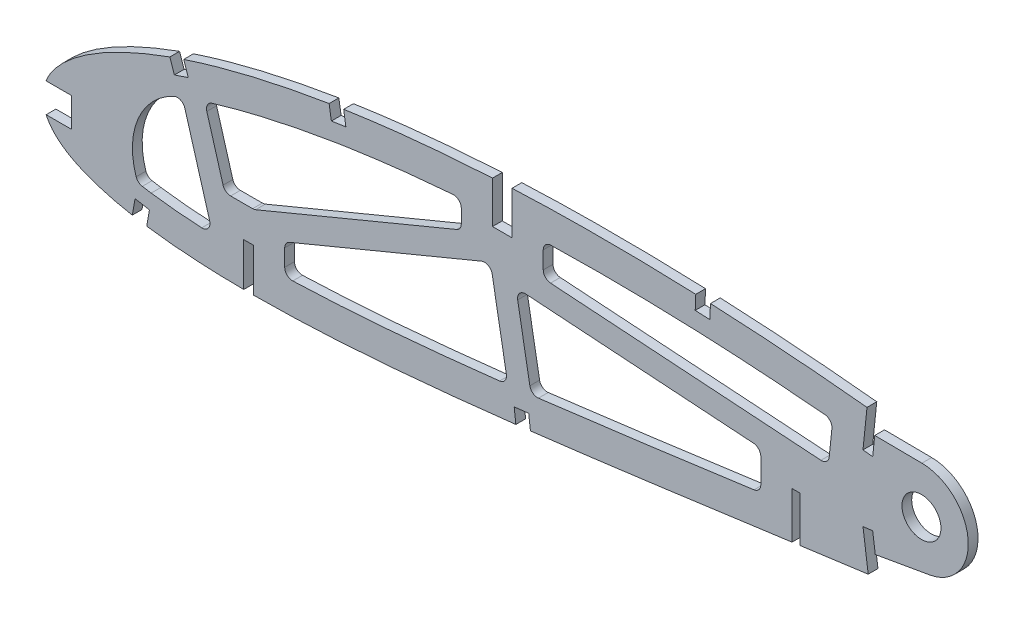
from build123d import *

# Parameters (mm, degrees)
BOSS_EXTRUDE1_DEPTH = 3.175
CUT_EXTRUDE1_DEPTH  = 7.62
SKETCH3_R           = 6.35
CUT_EXTRUDE2_DEPTH  = 7.62
CUT_EXTRUDE3_DEPTH  = 425.770685521
CUT_EXTRUDE4_START  = -3.175
CUT_EXTRUDE4_DEPTH  = 3.175
FILLET1_R           = 2.54


# Read off the part's stored shape, not the designer's step: Cut-Extrude4
with BuildPart() as part:
    # Sketch1 → Boss-Extrude1 (new body)
    with BuildSketch(Plane.XY):
        with BuildLine():
            Line((417.491116248, -0.651692804), (421.450974812, -1.472467044))
            Line((421.450974812, -1.472467044), (418.012470552, 0.651692804))
            add(Edge.make_bspline(
                [(418.012470552, 0.651692804), (417.98044815, 0.671474864), (417.852482746, 0.75052638), (417.564153255, 0.927383578), (417.084024874, 1.221948394), (416.411887136, 1.63217468), (415.548261806, 2.156972941), (414.492714479, 2.792668486), (413.245904156, 3.537195961), (411.808132787, 4.387034494), (410.179547234, 5.338203991), (408.360768057, 6.386852134), (406.351953186, 7.52704122), (404.153880987, 8.754112876), (401.767305606, 10.062231026), (399.19267854, 11.445487716), (396.430921499, 12.896846477), (393.483094762, 14.410065077), (390.349735958, 15.976787411), (387.032322118, 17.590492828), (383.53195848, 19.243135295), (379.849840019, 20.925898146), (375.98808191, 22.631921026), (371.947751923, 24.35059805), (367.731152528, 26.074482818), (363.340078768, 27.793764201), (358.777130588, 29.500612257), (354.044068493, 31.183969527), (349.144430575, 32.836479872), (344.080593504, 34.447407706), (338.856178603, 36.008004406), (333.474221444, 37.508151761), (327.939208494, 38.940156234), (322.254650095, 40.293589254), (316.425364207, 41.559391603), (310.455984511, 42.72994226), (304.351517267, 43.793554912), (298.12887857, 44.749400354), (291.888189265, 45.544501897), (285.660339717, 46.324314327), (279.441765017, 47.05687676), (273.147186285, 47.758406613), (266.78265934, 48.424954116), (260.354497207, 49.054435041), (253.869207533, 49.644132572), (247.333529654, 50.192317352), (240.75378784, 50.695883209), (234.13692006, 51.154054264), (227.48946797, 51.562802699), (220.818511901, 51.921821557), (214.130823757, 52.228606963), (207.433363169, 52.481045058), (200.733241899, 52.677611966), (194.03741489, 52.816424499), (187.353132032, 52.896609907), (180.687346008, 52.915977167), (174.047303325, 52.874179852), (167.439957194, 52.769782806), (160.872561498, 52.601356868), (154.352078932, 52.36858769), (147.885560384, 52.071576223), (141.480086041, 51.707835252), (135.142604697, 51.279682727), (128.880173648, 50.78532016), (122.699673543, 50.224616012), (116.607581601, 49.599907517), (110.610680398, 48.90949561), (104.715396798, 48.155344678), (98.928179068, 47.338933301), (93.255520599, 46.45981687), (87.703498103, 45.520534547), (82.278103773, 44.522047456), (76.985077668, 43.467282827), (71.830182495, 42.356515787), (66.818874958, 41.193078409), (61.956363154, 39.97899758), (57.247874135, 38.716495991), (52.698180969, 37.408603084), (48.311884381, 36.058286041), (44.094097756, 34.667028605), (40.048008795, 33.240105797), (36.178587704, 31.778530584), (32.488798598, 30.286805616), (28.982965605, 28.766967771), (25.66370775, 27.223650228), (22.534781646, 25.658610062), (19.59841729, 24.076231981), (16.857562593, 22.478942324), (14.314855879, 20.869707996), (11.971365892, 19.2526108), (9.830323596, 17.628665848), (7.892464518, 16.001976699), (6.159015004, 14.37502038), (4.632452775, 12.748917707), (3.312722951, 11.12653219), (2.201555106, 9.509148701), (1.299141963, 7.898297704), (0.607524637, 6.295149332), (0.126017388, 4.70060514), (-0.137556514, 3.117018659), (-0.203161624, 1.54312034), (-0.067619355, 0.51360488), (0, 0)],
                knots=[0, 0, 0, 0, 0.00025409, 0.001015373, 0.002283359, 0.004056577, 0.006330981, 0.009105275, 0.01237449, 0.016134023, 0.020379661, 0.025105976, 0.030306237, 0.035972206, 0.042099523, 0.048678063, 0.055701664, 0.063160184, 0.071045824, 0.079349826, 0.08806291, 0.097175756, 0.106678112, 0.116561573, 0.126814275, 0.137428301, 0.148393618, 0.15969976, 0.171338125, 0.183297699, 0.195569604, 0.208143556, 0.221011593, 0.234161831, 0.24758745, 0.261276822, 0.27522271, 0.289414144, 0.3037712, 0.317689227, 0.331784111, 0.346039677, 0.36044387, 0.37498272, 0.389640454, 0.404403317, 0.419256601, 0.434186749, 0.449177265, 0.464214782, 0.479284009, 0.49436974, 0.509457833, 0.524532346, 0.53957932, 0.554582984, 0.569529546, 0.584403417, 0.599190992, 0.613876838, 0.628447475, 0.642888675, 0.657186054, 0.671325546, 0.685294014, 0.699078147, 0.712665095, 0.726042645, 0.739197713, 0.752117586, 0.764792042, 0.777208152, 0.789355685, 0.80122396, 0.812803686, 0.824082909, 0.835054602, 0.845709571, 0.856037853, 0.866033834, 0.875688843, 0.884997719, 0.893953426, 0.902552897, 0.910789386, 0.918660734, 0.926166253, 0.933302626, 0.94007122, 0.94647478, 0.952517526, 0.958204819, 0.963546652, 0.9685566, 0.973249913, 0.977651041, 0.981787043, 0.985694226, 0.989415109, 0.993001157, 0.996508416, 1, 1, 1, 1], degree=3))
            add(Edge.make_bspline(
                [(0, 0), (0.107344122, -0.506735851), (0.322525701, -1.522536416), (0.907145976, -2.98486836), (1.680278374, -4.390592942), (2.658149173, -5.735976229), (3.834256448, -7.020650547), (5.206002713, -8.245952015), (6.772042592, -9.411221952), (8.530326502, -10.515929932), (10.478300238, -11.56124868), (12.613774275, -12.546528288), (14.934801506, -13.471460836), (17.438853083, -14.334810006), (20.122867794, -15.137890506), (22.984293745, -15.87874546), (26.019877259, -16.558410209), (29.226698653, -17.175149915), (32.601263508, -17.729591078), (36.140066093, -18.221423529), (39.839474107, -18.650954746), (43.695858135, -19.017283569), (47.705403835, -19.321197808), (51.864114831, -19.562899166), (56.167954337, -19.743154049), (60.612799743, -19.861277173), (65.194297816, -19.919110149), (69.90830817, -19.917521134), (74.750219376, -19.856085207), (79.715895302, -19.738196204), (84.800570833, -19.563107476), (89.999655516, -19.33293774), (95.308459722, -19.050003416), (100.722222022, -18.715263595), (106.236178133, -18.330201822), (111.845540422, -17.897906181), (117.545213296, -17.419454845), (123.330225884, -16.897636702), (129.195456677, -16.33506396), (135.135838219, -15.733517171), (141.146127059, -15.095825988), (147.22096994, -14.424056849), (153.355199033, -13.721793599), (159.543210771, -12.990306925), (165.779772492, -12.233773195), (172.059017171, -11.453637843), (178.375694094, -10.652905812), (184.724121999, -9.835347203), (191.098357706, -9.000868908), (197.493040005, -8.155416157), (203.902002084, -7.29829268), (210.319665377, -6.433906623), (216.740089126, -5.564944849), (223.157019771, -4.691674703), (229.564816603, -3.817715282), (235.957535291, -2.945465763), (242.328914049, -2.075005893), (248.673188486, -1.210662101), (254.983970072, -0.352328891), (261.255439585, 0.498253703), (267.481587275, 1.33854664), (273.656539031, 2.167489343), (279.773925067, 2.98455751), (285.827590721, 3.790057847), (291.72081698, 4.559541474), (297.438204766, 5.333983617), (302.999020517, 5.96885451), (308.4905971, 6.510739718), (313.918638837, 6.955010775), (319.276627913, 7.30805944), (324.558425157, 7.572408429), (329.75773577, 7.751748326), (334.867992319, 7.851399579), (339.882811875, 7.873890942), (344.79534958, 7.826395206), (349.599216077, 7.712740899), (354.287706783, 7.538029372), (358.854280799, 7.308155071), (363.292451785, 7.029384641), (367.595556763, 6.705830062), (371.757599447, 6.34504489), (375.772158368, 5.952310734), (379.633069209, 5.532114413), (383.334698301, 5.093260959), (386.871120866, 4.638639591), (390.237017411, 4.175721536), (393.426969843, 3.709197789), (396.435926147, 3.245024667), (399.259158851, 2.787630174), (401.892107523, 2.343085233), (404.330647739, 1.915543252), (406.570547937, 1.509179531), (408.608700706, 1.129121201), (410.44108076, 0.777256216), (412.065237404, 0.459383467), (413.478150672, 0.176905414), (414.67774925, -0.066198026), (415.661938268, -0.268967448), (416.429222922, -0.428074261), (416.978087732, -0.54377272), (417.307939008, -0.612619163), (417.454496179, -0.643881356), (417.491116248, -0.651692804)],
                knots=[0, 0, 0, 0, 0.003638255, 0.007293231, 0.011028136, 0.014901081, 0.018963272, 0.023258475, 0.027820626, 0.032679082, 0.03785316, 0.043361875, 0.049214679, 0.055422346, 0.061988786, 0.068918036, 0.076211157, 0.083868392, 0.091887411, 0.100265912, 0.108999867, 0.118084529, 0.127514843, 0.13728527, 0.147387917, 0.157816481, 0.168563473, 0.179619128, 0.190977373, 0.202626974, 0.214560478, 0.226767249, 0.239236417, 0.251959004, 0.264923894, 0.278119703, 0.291536035, 0.30516028, 0.318980685, 0.332985499, 0.34716279, 0.361498603, 0.375980747, 0.390597192, 0.405332593, 0.420174823, 0.435109533, 0.450124276, 0.465203068, 0.480333154, 0.495500583, 0.510689775, 0.525887334, 0.541078314, 0.556247233, 0.571381784, 0.58646604, 0.601484516, 0.616424329, 0.631269422, 0.646006524, 0.660620684, 0.675098187, 0.689422858, 0.703581825, 0.716907563, 0.730009275, 0.742952128, 0.755725558, 0.768319952, 0.780724338, 0.792926529, 0.804916041, 0.816679084, 0.828203524, 0.8394749, 0.850481359, 0.861207697, 0.871639326, 0.881763414, 0.891563605, 0.901027365, 0.910138977, 0.918883977, 0.927249278, 0.935221104, 0.942784738, 0.949928188, 0.956638464, 0.962904203, 0.968712288, 0.974054485, 0.978918432, 0.983297218, 0.987180246, 0.990560674, 0.993433357, 0.995790625, 0.997629587, 0.998945816, 0.999736592, 1, 1, 1, 1], degree=3))
        make_face()
    extrude(amount=BOSS_EXTRUDE1_DEPTH)

    # Sketch2 → Cut-Extrude1 (cut)
    with BuildSketch(Plane(origin=(0, 0, 0), x_dir=(-1, 0, 0), z_dir=(0, 0, -1))):
        Polygon((-246.1398005, 13.222249128), (-243.5998005, 13.222249128), (-243.5998005, -1.577878971), (-243.5998005, -2.583505772), (-246.1398005, -3.589132574), (-246.1398005, -1.577878971), align=None)
        Polygon((-146.1273005, 52.250888132), (-146.1273005, 38.315323735), (-152.4773005, 38.315323735), (-152.4773005, 52.250888132), (-152.4773005, 56.412172178), (-146.1273005, 53.817674238), align=None)
        Polygon((-65.1648005, -5.846825906), (-65.1648005, -19.360858789), (-65.1648005, -20.266335855), (-68.3398005, -21.17181292), (-68.3398005, -19.360858789), (-68.3398005, -5.846825906), align=None)
    extrude(amount=-CUT_EXTRUDE1_DEPTH, mode=Mode.SUBTRACT)

    # Sketch3 → Cut-Extrude2 (cut)
    with BuildSketch(Plane(origin=(0, 0, 0), x_dir=(-1, 0, 0), z_dir=(0, 0, -1))):
        with Locations((-285.729166098, 26.255421435)):
            Circle(SKETCH3_R)
    extrude(amount=-CUT_EXTRUDE2_DEPTH, mode=Mode.SUBTRACT)

    # Sketch4 → Cut-Extrude3 (cut, through all)
    with BuildSketch(Plane.XY.offset(3.175)):
        with BuildLine():
            add(Edge.make_bspline(
                [(0.808924482, 6.729728671), (0.746125984, 6.573479363), (0.488545499, 5.901141778), (0.126017388, 4.70060514), (-0.137556514, 3.117018659), (-0.203161624, 1.54312034), (-0.067619355, 0.51360488), (0, 0)],
                knots=[0.98455802, 0.98455802, 0.98455802, 0.98455802, 0.985694226, 0.989415109, 0.993001157, 0.996508416, 1, 1, 1, 1], degree=3))
            Line((0.808924482, 6.729728671), (-0.434569064, 6.729728671))
            Line((-0.434569064, 6.729728671), (-0.434569064, -2.795271329))
            Line((-0.434569064, -2.795271329), (0.85480102, -2.795271329))
            add(Edge.make_bspline(
                [(0, 0), (0.107344122, -0.506735851), (0.309971484, -1.463272138), (0.66462239, -2.376609764), (0.85480102, -2.795271329)],
                knots=[0, 0, 0, 0, 0.003638255, 0.006867726, 0.006867726, 0.006867726, 0.006867726], degree=3))
        make_face()
        with BuildLine():
            Line((9.090430936, 6.729728671), (0.808924482, 6.729728671))
            add(Edge.make_bspline(
                [(0.808924482, 6.729728671), (0.746125984, 6.573479363), (0.488545499, 5.901141778), (0.126017388, 4.70060514), (-0.137556514, 3.117018659), (-0.203161624, 1.54312034), (-0.067619355, 0.51360488), (0, 0)],
                knots=[0.98455802, 0.98455802, 0.98455802, 0.98455802, 0.985694226, 0.989415109, 0.993001157, 0.996508416, 1, 1, 1, 1], degree=3))
            add(Edge.make_bspline(
                [(0, 0), (0.107344122, -0.506735851), (0.309971484, -1.463272138), (0.66462239, -2.376609764), (0.85480102, -2.795271329)],
                knots=[0, 0, 0, 0, 0.003638255, 0.006867726, 0.006867726, 0.006867726, 0.006867726], degree=3))
            Line((0.85480102, -2.795271329), (9.090430936, -2.795271329))
            Line((9.090430936, -2.795271329), (9.090430936, 6.729728671))
        make_face()
        with BuildLine():
            Line((47.095746851, 30.788897048), (45.613345739, 35.163346299))
            add(Edge.make_bspline(
                [(45.613345739, 35.163346299), (45.091929097, 34.989758836), (43.587474496, 34.482580246), (42.088727049, 33.958655357), (41.111542776, 33.608338967)],
                knots=[0.862324123, 0.862324123, 0.862324123, 0.862324123, 0.866033834, 0.873041311, 0.873041311, 0.873041311, 0.873041311], degree=3))
            Line((41.111542776, 33.608338967), (42.585351914, 29.260286017))
            Line((42.585351914, 29.260286017), (47.095746851, 30.788897048))
        make_face()
        with BuildLine():
            Line((28.958796336, -16.69130681), (28.886611513, -17.098683548))
            add(Edge.make_bspline(
                [(28.886611513, -17.098683548), (28.983956243, -17.116313504), (30.203280781, -17.335602404), (31.766176136, -17.592386184), (33.234935845, -17.809985448), (33.576226442, -17.859319497)],
                knots=[0.083172483, 0.083172483, 0.083172483, 0.083172483, 0.083868392, 0.091887411, 0.094313197, 0.094313197, 0.094313197, 0.094313197], degree=3))
            Line((33.576226442, -17.859319497), (33.62140449, -17.603292147))
            Line((33.62140449, -17.603292147), (34.473115451, -12.82541996))
            Line((34.473115451, -12.82541996), (29.791019841, -11.99463396))
            Line((29.791019841, -11.99463396), (28.958796336, -16.69130681))
        make_face()
        with BuildLine():
            add(Edge.make_bspline(
                [(28.886611513, -17.098683548), (28.983956243, -17.116313504), (30.203280781, -17.335602404), (31.766176136, -17.592386184), (33.234935845, -17.809985448), (33.576226442, -17.859319497)],
                knots=[0.083172483, 0.083172483, 0.083172483, 0.083172483, 0.083868392, 0.091887411, 0.094313197, 0.094313197, 0.094313197, 0.094313197], degree=3))
            Line((28.886611513, -17.098683548), (28.234219174, -20.780475001))
            Line((28.234219174, -20.780475001), (32.914427868, -21.609781152))
            Line((32.914427868, -21.609781152), (33.576226442, -17.859319497))
        make_face()
        with BuildLine():
            Line((98.390110119, 42.539324004), (97.692111881, 47.140856254))
            add(Edge.make_bspline(
                [(97.692111881, 47.140856254), (96.200738934, 46.915642302), (94.6181591, 46.667982915), (93.037076443, 46.41107762), (92.944757138, 46.396044482)],
                knots=[0.741935951, 0.741935951, 0.741935951, 0.741935951, 0.752117586, 0.752748995, 0.752748995, 0.752748995, 0.752748995], degree=3))
            Line((92.944757138, 46.396044482), (93.681498318, 41.82505439))
            Line((93.681498318, 41.82505439), (98.390110119, 42.539324004))
        make_face()
        with BuildLine():
            add(Edge.make_bspline(
                [(153.726942618, -13.674670995), (155.307088631, -13.490469004), (156.886976839, -13.304057017), (158.46663779, -13.115738963)],
                knots=[0.376904149, 0.376904149, 0.376904149, 0.376904149, 0.388095317, 0.388095317, 0.388095317, 0.388095317], degree=3))
            Line((158.46663779, -13.115738963), (157.911211307, -8.426250803))
            Line((157.911211307, -8.426250803), (153.181769238, -8.986407259))
            Line((153.181769238, -8.986407259), (153.726942618, -13.674670995))
        make_face()
        with BuildLine():
            Line((216.8479356, 47.447146506), (217.065084622, 52.091640269))
            add(Edge.make_bspline(
                [(217.065084622, 52.091640269), (216.087761412, 52.13595805), (214.49249745, 52.205473111), (212.897038625, 52.270330547), (212.27907291, 52.294747694)],
                knots=[0.47267979, 0.47267979, 0.47267979, 0.47267979, 0.479284009, 0.483458853, 0.483458853, 0.483458853, 0.483458853], degree=3))
            Line((212.27907291, 52.294747694), (212.090534877, 47.662289832))
            Line((212.090534877, 47.662289832), (216.8479356, 47.447146506))
        make_face()
        Polygon((269.854166098, 35.324497595), (271.193876282, 47.947113979), (268.007090362, 48.283416821), (266.696357119, 35.652180905), align=None)
        with BuildLine():
            Line((268.007090362, 59.190949799), (268.007090362, 48.292841244))
            add(Edge.make_bspline(
                [(418.012470552, 0.651692804), (417.98044815, 0.671474864), (417.852482746, 0.75052638), (417.564153255, 0.927383578), (417.084024874, 1.221948394), (416.411887136, 1.63217468), (415.548261806, 2.156972941), (414.492714479, 2.792668486), (413.245904156, 3.537195961), (411.808132787, 4.387034494), (410.179547234, 5.338203991), (408.360768057, 6.386852134), (406.351953186, 7.52704122), (404.153880987, 8.754112876), (401.767305606, 10.062231026), (399.19267854, 11.445487716), (396.430921499, 12.896846477), (393.483094762, 14.410065077), (390.349735958, 15.976787411), (387.032322118, 17.590492828), (383.53195848, 19.243135295), (379.849840019, 20.925898146), (375.98808191, 22.631921026), (371.947751923, 24.35059805), (367.731152528, 26.074482818), (363.340078768, 27.793764201), (358.777130588, 29.500612257), (354.044068493, 31.183969527), (349.144430575, 32.836479872), (344.080593504, 34.447407706), (338.856178603, 36.008004406), (333.474221444, 37.508151761), (327.939208494, 38.940156234), (322.254650095, 40.293589254), (316.425364207, 41.559391603), (310.455984511, 42.72994226), (304.351517267, 43.793554912), (298.12887857, 44.749400354), (291.888189265, 45.544501897), (285.660339717, 46.324314327), (279.441765017, 47.05687676), (273.548557229, 47.713673882), (269.727986819, 48.116237701), (268.007090362, 48.292841244)],
                knots=[0, 0, 0, 0, 0.00025409, 0.001015373, 0.002283359, 0.004056577, 0.006330981, 0.009105275, 0.01237449, 0.016134023, 0.020379661, 0.025105976, 0.030306237, 0.035972206, 0.042099523, 0.048678063, 0.055701664, 0.063160184, 0.071045824, 0.079349826, 0.08806291, 0.097175756, 0.106678112, 0.116561573, 0.126814275, 0.137428301, 0.148393618, 0.15969976, 0.171338125, 0.183297699, 0.195569604, 0.208143556, 0.221011593, 0.234161831, 0.24758745, 0.261276822, 0.27522271, 0.289414144, 0.3037712, 0.317689227, 0.331784111, 0.346039677, 0.357717639, 0.357717639, 0.357717639, 0.357717639], degree=3))
            Line((418.012470552, 0.651692804), (421.450974812, -1.472467044))
            Line((421.450974812, -1.472467044), (417.491116248, -0.651692804))
            add(Edge.make_bspline(
                [(271.538932914, 1.882989298), (272.251238806, 1.978537975), (275.003323158, 2.347372455), (279.773925067, 2.98455751), (285.827590721, 3.790057847), (291.72081698, 4.559541474), (297.438204766, 5.333983617), (302.999020517, 5.96885451), (308.4905971, 6.510739718), (313.918638837, 6.955010775), (319.276627913, 7.30805944), (324.558425157, 7.572408429), (329.75773577, 7.751748326), (334.867992319, 7.851399579), (339.882811875, 7.873890942), (344.79534958, 7.826395206), (349.599216077, 7.712740899), (354.287706783, 7.538029372), (358.854280799, 7.308155071), (363.292451785, 7.029384641), (367.595556763, 6.705830062), (371.757599447, 6.34504489), (375.772158368, 5.952310734), (379.633069209, 5.532114413), (383.334698301, 5.093260959), (386.871120866, 4.638639591), (390.237017411, 4.175721536), (393.426969843, 3.709197789), (396.435926147, 3.245024667), (399.259158851, 2.787630174), (401.892107523, 2.343085233), (404.330647739, 1.915543252), (406.570547937, 1.509179531), (408.608700706, 1.129121201), (410.44108076, 0.777256216), (412.065237404, 0.459383467), (413.478150672, 0.176905414), (414.67774925, -0.066198026), (415.661938268, -0.268967448), (416.429222922, -0.428074261), (416.978087732, -0.54377272), (417.307939008, -0.612619163), (417.454496179, -0.643881356), (417.491116248, -0.651692804)],
                knots=[0.655564925, 0.655564925, 0.655564925, 0.655564925, 0.660620684, 0.675098187, 0.689422858, 0.703581825, 0.716907563, 0.730009275, 0.742952128, 0.755725558, 0.768319952, 0.780724338, 0.792926529, 0.804916041, 0.816679084, 0.828203524, 0.8394749, 0.850481359, 0.861207697, 0.871639326, 0.881763414, 0.891563605, 0.901027365, 0.910138977, 0.918883977, 0.927249278, 0.935221104, 0.942784738, 0.949928188, 0.956638464, 0.962904203, 0.968712288, 0.974054485, 0.978918432, 0.983297218, 0.987180246, 0.990560674, 0.993433357, 0.995790625, 0.997629587, 0.998945816, 0.999736592, 1, 1, 1, 1], degree=3))
            Line((271.538932914, 1.882989298), (271.541903028, 1.860837103))
            Line((271.541903028, 1.860837103), (268.397911259, 1.438992558))
            Line((268.397911259, 1.438992558), (268.397911259, -17.603292147))
            Line((268.397911259, -17.603292147), (444.301922543, -17.603292147))
            Line((444.301922543, -17.603292147), (444.301922543, 59.190949799))
            Line((444.301922543, 59.190949799), (268.007090362, 59.190949799))
        make_face()
        with BuildLine():
            Line((268.007090362, 48.292841244), (268.007090362, 48.283416821))
            Line((268.007090362, 48.283416821), (271.193876282, 47.947113979))
            Line((271.193876282, 47.947113979), (270.52402119, 41.635805787))
            Line((270.52402119, 41.635805787), (285.869221274, 41.49477787))
            ThreePointArc((285.869221274, 41.49477787), (296.554877181, 36.982097507), (300.969166098, 26.255421435))
            ThreePointArc((300.969166098, 26.255421435), (297.39701369, 16.451395089), (288.355132951, 11.243363012))
            Line((288.355132951, 11.243363012), (270.698034563, 8.154715622))
            Line((270.698034563, 8.154715622), (271.538932914, 1.882989298))
            add(Edge.make_bspline(
                [(271.538932914, 1.882989298), (272.251238806, 1.978537975), (275.003323158, 2.347372455), (279.773925067, 2.98455751), (285.827590721, 3.790057847), (291.72081698, 4.559541474), (297.438204766, 5.333983617), (302.999020517, 5.96885451), (308.4905971, 6.510739718), (313.918638837, 6.955010775), (319.276627913, 7.30805944), (324.558425157, 7.572408429), (329.75773577, 7.751748326), (334.867992319, 7.851399579), (339.882811875, 7.873890942), (344.79534958, 7.826395206), (349.599216077, 7.712740899), (354.287706783, 7.538029372), (358.854280799, 7.308155071), (363.292451785, 7.029384641), (367.595556763, 6.705830062), (371.757599447, 6.34504489), (375.772158368, 5.952310734), (379.633069209, 5.532114413), (383.334698301, 5.093260959), (386.871120866, 4.638639591), (390.237017411, 4.175721536), (393.426969843, 3.709197789), (396.435926147, 3.245024667), (399.259158851, 2.787630174), (401.892107523, 2.343085233), (404.330647739, 1.915543252), (406.570547937, 1.509179531), (408.608700706, 1.129121201), (410.44108076, 0.777256216), (412.065237404, 0.459383467), (413.478150672, 0.176905414), (414.67774925, -0.066198026), (415.661938268, -0.268967448), (416.429222922, -0.428074261), (416.978087732, -0.54377272), (417.307939008, -0.612619163), (417.454496179, -0.643881356), (417.491116248, -0.651692804)],
                knots=[0.655564925, 0.655564925, 0.655564925, 0.655564925, 0.660620684, 0.675098187, 0.689422858, 0.703581825, 0.716907563, 0.730009275, 0.742952128, 0.755725558, 0.768319952, 0.780724338, 0.792926529, 0.804916041, 0.816679084, 0.828203524, 0.8394749, 0.850481359, 0.861207697, 0.871639326, 0.881763414, 0.891563605, 0.901027365, 0.910138977, 0.918883977, 0.927249278, 0.935221104, 0.942784738, 0.949928188, 0.956638464, 0.962904203, 0.968712288, 0.974054485, 0.978918432, 0.983297218, 0.987180246, 0.990560674, 0.993433357, 0.995790625, 0.997629587, 0.998945816, 0.999736592, 1, 1, 1, 1], degree=3))
            Line((417.491116248, -0.651692804), (421.450974812, -1.472467044))
            Line((421.450974812, -1.472467044), (418.012470552, 0.651692804))
            add(Edge.make_bspline(
                [(418.012470552, 0.651692804), (417.98044815, 0.671474864), (417.852482746, 0.75052638), (417.564153255, 0.927383578), (417.084024874, 1.221948394), (416.411887136, 1.63217468), (415.548261806, 2.156972941), (414.492714479, 2.792668486), (413.245904156, 3.537195961), (411.808132787, 4.387034494), (410.179547234, 5.338203991), (408.360768057, 6.386852134), (406.351953186, 7.52704122), (404.153880987, 8.754112876), (401.767305606, 10.062231026), (399.19267854, 11.445487716), (396.430921499, 12.896846477), (393.483094762, 14.410065077), (390.349735958, 15.976787411), (387.032322118, 17.590492828), (383.53195848, 19.243135295), (379.849840019, 20.925898146), (375.98808191, 22.631921026), (371.947751923, 24.35059805), (367.731152528, 26.074482818), (363.340078768, 27.793764201), (358.777130588, 29.500612257), (354.044068493, 31.183969527), (349.144430575, 32.836479872), (344.080593504, 34.447407706), (338.856178603, 36.008004406), (333.474221444, 37.508151761), (327.939208494, 38.940156234), (322.254650095, 40.293589254), (316.425364207, 41.559391603), (310.455984511, 42.72994226), (304.351517267, 43.793554912), (298.12887857, 44.749400354), (291.888189265, 45.544501897), (285.660339717, 46.324314327), (279.441765017, 47.05687676), (273.548557229, 47.713673882), (269.727986819, 48.116237701), (268.007090362, 48.292841244)],
                knots=[0, 0, 0, 0, 0.00025409, 0.001015373, 0.002283359, 0.004056577, 0.006330981, 0.009105275, 0.01237449, 0.016134023, 0.020379661, 0.025105976, 0.030306237, 0.035972206, 0.042099523, 0.048678063, 0.055701664, 0.063160184, 0.071045824, 0.079349826, 0.08806291, 0.097175756, 0.106678112, 0.116561573, 0.126814275, 0.137428301, 0.148393618, 0.15969976, 0.171338125, 0.183297699, 0.195569604, 0.208143556, 0.221011593, 0.234161831, 0.24758745, 0.261276822, 0.27522271, 0.289414144, 0.3037712, 0.317689227, 0.331784111, 0.346039677, 0.357717639, 0.357717639, 0.357717639, 0.357717639], degree=3))
        make_face()
        with BuildLine():
            Line((271.538932914, 1.882989298), (270.698034563, 8.154715622))
            Line((270.698034563, 8.154715622), (269.854166098, 14.44859414))
            Line((269.854166098, 14.44859414), (266.707421324, 14.025971657))
            Line((266.707421324, 14.025971657), (268.394995539, 1.460702306))
            add(Edge.make_bspline(
                [(268.394995539, 1.460702306), (269.442949868, 1.601649355), (270.490929266, 1.74241014), (271.538932914, 1.882989298)],
                knots=[0.648126471, 0.648126471, 0.648126471, 0.648126471, 0.655564925, 0.655564925, 0.655564925, 0.655564925], degree=3))
        make_face()
    extrude(amount=-CUT_EXTRUDE3_DEPTH, mode=Mode.SUBTRACT)

    # Cut-Extrude4 outline → Cut-Extrude4 (cut)
    with BuildSketch(Plane.XY.offset(3.175).offset(CUT_EXTRUDE4_START)):
        with BuildLine():
            Line((30.697218976, -7.101318865), (35.029761741, -7.803831685))
            add(Edge.make_bspline(
                [(35.029761741, -7.803831685), (36.661368819, -8.039682847), (39.9196734, -8.451595147), (44.843546302, -8.92594214), (48.421879675, -9.181359348), (50.626956818, -9.311330424), (51.209343896, -9.343517934), (51.500732284, -9.359099419)],
                knots=[0.094313197, 0.094313197, 0.094313197, 0.094313197, 0.106689701, 0.119066205, 0.130991827, 0.133129725, 0.135267622, 0.135267622, 0.135267622, 0.135267622], degree=3))
            ThreePointArc((51.500732284, -9.359099419), (53.626790797, -8.400629141), (54.074888478, -6.111961725))
            Line((54.074888478, -6.111961725), (45.217042022, 24.278134387))
            Line((45.217042022, 24.278134387), (44.540193306, 24.04434631))
            ThreePointArc((44.540193306, 24.04434631), (30.957967963, 11.431939422), (30.697218976, -7.101318865))
        make_face()
        with BuildLine():
            Line((78.4998005, 0.188286617), (78.4998005, -9.599408468))
            add(Edge.make_bspline(
                [(78.4998005, -9.599408468), (81.570321031, -9.516206907), (87.701912305, -9.287783265), (100.01827676, -8.623808355), (115.440971355, -7.461145915), (133.504249546, -5.726592642), (145.409936006, -4.409957926), (151.11642969, -3.749579849)],
                knots=[0.200515055, 0.200515055, 0.200515055, 0.200515055, 0.222563692, 0.244612329, 0.288709602, 0.332806876, 0.373495308, 0.373495308, 0.373495308, 0.373495308], degree=3))
            Line((151.11642969, -3.749579849), (145.465161493, 27.970914322))
            Line((145.465161493, 27.970914322), (78.4998005, 0.188286617))
        make_face()
        with BuildLine():
            Line((99.209184779, 37.094758016), (94.57768833, 36.368126666))
            add(Edge.make_bspline(
                [(94.57768833, 36.368126666), (90.678031605, 35.733112377), (82.886034376, 34.34483719), (71.339527978, 31.886474174), (61.491479851, 29.389170154), (55.245085533, 27.564625966), (52.753298926, 26.78997811), (52.449712021, 26.69488431)],
                knots=[0.752748995, 0.752748995, 0.752748995, 0.752748995, 0.780142777, 0.807536559, 0.834930341, 0.851093989, 0.853340016, 0.853340016, 0.853340016, 0.853340016], degree=3))
            Line((52.449712021, 26.69488431), (58.973342345, 4.313174094))
            Line((58.973342345, 4.313174094), (68.557451566, 4.313174094))
            Line((68.557451566, 4.313174094), (135.9673005, 32.280211212))
            Line((135.9673005, 32.280211212), (135.9673005, 41.140908748))
            add(Edge.make_bspline(
                [(135.9673005, 41.140908748), (132.887061583, 40.915784054), (126.728162081, 40.412774842), (117.517415443, 39.496033614), (108.33848054, 38.403867609), (102.250057125, 37.553963664), (99.209184779, 37.094758016)],
                knots=[0.656945617, 0.656945617, 0.656945617, 0.656945617, 0.678193201, 0.699440784, 0.720688367, 0.741935951, 0.741935951, 0.741935951, 0.741935951], degree=3))
        make_face()
        with BuildLine():
            Line((153.745827532, 24.93608513), (158.697179418, -2.855787986))
            add(Edge.make_bspline(
                [(158.697179418, -2.855787986), (158.816621112, -2.841462006), (164.67896688, -2.137795324), (176.879264337, -0.618435295), (195.321970019, 1.794492649), (214.370503466, 4.361920266), (227.08488071, 6.0977828), (233.4398005, 6.965246248)],
                knots=[0.391497157, 0.391497157, 0.391497157, 0.391497157, 0.392347617, 0.433236123, 0.478376929, 0.523517735, 0.568658541, 0.568658541, 0.568658541, 0.568658541], degree=3))
            Line((233.4398005, 6.965246248), (233.4398005, 19.563601407))
            Line((233.4398005, 19.563601407), (153.745827532, 24.93608513))
        make_face()
        with BuildLine():
            Line((216.604841352, 41.942070026), (211.877942588, 42.142669362))
            add(Edge.make_bspline(
                [(211.877942588, 42.142669362), (207.772481684, 42.3048849), (199.556996478, 42.56659267), (187.240707727, 42.761700784), (174.929022278, 42.748858014), (166.734759814, 42.59447938), (162.6373005, 42.478086908)],
                knots=[0.483458853, 0.483458853, 0.483458853, 0.483458853, 0.511552783, 0.539646714, 0.567740644, 0.595834575, 0.595834575, 0.595834575, 0.595834575], degree=3))
            Line((162.6373005, 42.478086908), (162.6373005, 31.973971456))
            Line((162.6373005, 31.973971456), (255.45084093, 25.717046163))
            Line((255.45084093, 25.717046163), (256.846774266, 39.169335854))
            add(Edge.make_bspline(
                [(256.846774266, 39.169335854), (256.028838825, 39.244287239), (251.01655364, 39.696851619), (241.805739801, 40.452315554), (229.208492417, 41.306280341), (220.807369302, 41.751501838), (216.604841352, 41.942070026)],
                knots=[0.380852904, 0.380852904, 0.380852904, 0.380852904, 0.386458177, 0.415198715, 0.443939252, 0.47267979, 0.47267979, 0.47267979, 0.47267979], degree=3))
        make_face()
    extrude(amount=CUT_EXTRUDE4_DEPTH, mode=Mode.SUBTRACT)

    # Fillet1
    fillet1_edges = [part.edges().sort_by_distance(p)[0] for p in [
        (233.4398005, 19.563601407, 1.5875),
        (233.4398005, 6.965246248, 1.5875),
        (153.745827532, 24.93608513, 1.5875),
        (158.697179418, -2.855787986, 1.5875),
        (255.45084093, 25.717046163, 1.5875),
        (162.6373005, 42.478086908, 1.5875),
        (211.877942588, 42.142669362, 1.5875),
        (216.604841352, 41.942070026, 1.5875),
        (256.846774266, 39.169335854, 1.5875),
        (162.6373005, 31.973971456, 1.5875),
        (78.4998005, 0.188286617, 1.5875),
        (145.465161493, 27.970914322, 1.5875),
        (151.11642969, -3.749579849, 1.5875),
        (78.4998005, -9.599408468, 1.5875),
        (135.9673005, 32.280211212, 1.5875),
        (68.557451566, 4.313174094, 1.5875),
        (58.973342345, 4.313174094, 1.5875),
        (94.57768833, 36.368126666, 1.5875),
        (99.209184779, 37.094758016, 1.5875),
        (135.9673005, 41.140908748, 1.5875),
        (52.449712021, 26.69488431, 1.5875),
        (45.217042022, 24.278134387, 1.5875),
        (30.697218976, -7.101318865, 1.5875),
    ]]
    fillet(fillet1_edges, radius=FILLET1_R)


solid = part.part
